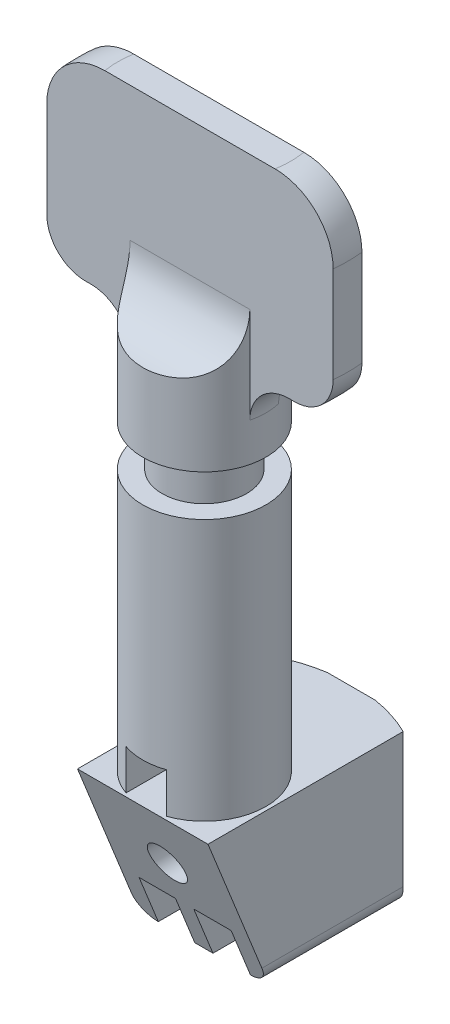
from build123d import *

# Parameters (mm, degrees)
BOSS_EXTRUDE1_DEPTH = 10
FILLET2_R           = 2
FILLET3_R           = 3
BOSS_EXTRUDE3_START = 5.5
SKETCH5_W           = 6.8
SKETCH5_H           = 15.3
SKETCH5_W_2         = 1.95
SKETCH5_H_2         = 13.3
SKETCH5_W_3         = 1.9
BOSS_EXTRUDE3_DEPTH = 2.5
SKETCH7_W           = 6.8
SKETCH7_H           = 15.3
BOSS_EXTRUDE4_DEPTH = 5.5
FILLET7_START       = -3.4
FILLET7_DEPTH       = 6.8
FILLET7_START_2     = -9
FILLET7_2_DEPTH     = 18
SKETCH8_R           = 0.975
CUT_EXTRUDE2_DEPTH  = 51.714038513
CUT_EXTRUDE4_DEPTH  = 50.587359306
CUT_EXTRUDE5_DEPTH  = 1.8
SKETCH14_R          = 1.95
CUT_EXTRUDE6_DEPTH  = 3.5
SKETCH17_W          = 2.1
SKETCH17_H          = 2.1
CUT_EXTRUDE8_DEPTH  = 51.714038513
BOSS_EXTRUDE5_START = -15.3
SKETCH18_W          = 1.9
SKETCH18_H          = 2
BOSS_EXTRUDE5_DEPTH = 15.3
SKETCH19_W          = 1.9
SKETCH19_H          = 0.1
CUT_EXTRUDE9_DEPTH  = 10.87055
SKETCH20_R          = 1.9
SKETCH20_R_2        = 1.075
BOSS_EXTRUDE6_DEPTH = 1.5
SKETCH21_R          = 12.317587445
SKETCH21_R_2        = 7.75
CUT_EXTRUDE10_DEPTH = 49.952489235


with BuildPart() as part:
    # Sketch1 → Revolve1 (revolve)
    with BuildSketch(Plane.XY, mode=Mode.PRIVATE) as revolve1_sk:
        Polygon((3.210554255, 37.765821371), (3.210554255, 33.765821371), (2.198784107, 33.765821371), (2.198784107, 31.615821371), (3.210554255, 31.615821371), (3.210554255, 18), (0, 18), (0, 37.765821371), align=None)
    revolve(revolve1_sk.sketch.rotate(Axis((0, 37.765821371, 0), (0, -1, 0)), 90), axis=Axis((0, 37.765821371, 0), (0, -1, 0)))

    # Sketch2 → Boss-Extrude1 (add)
    with BuildSketch(Plane(origin=(0, 37.765821371, 0), x_dir=(1, 0, 0), z_dir=(0, 1, 0))):
        with BuildLine():
            Line((3.121723662, 0.75), (-3.121723662, 0.75))
            ThreePointArc((-3.121723662, 0.75), (-3.210554255, 0), (-3.121723662, -0.75))
            Line((-3.121723662, -0.75), (3.121723662, -0.75))
            ThreePointArc((3.121723662, -0.75), (3.188269265, -0.377621131), (3.210554255, 0))
            ThreePointArc((3.210554255, 0), (3.188269265, 0.377621131), (3.121723662, 0.75))
        make_face()
        with BuildLine():
            Line((-3.121723662, 0.75), (-7.462405778, 0.75))
            ThreePointArc((-7.462405778, 0.75), (-7.5, 0), (-7.462405778, -0.75))
            Line((-7.462405778, -0.75), (-3.121723662, -0.75))
            ThreePointArc((-3.121723662, -0.75), (-3.210554255, 0), (-3.121723662, 0.75))
        make_face()
        with BuildLine():
            ThreePointArc((7.5, 0), (7.490595548, 0.375470813), (7.462405778, 0.75))
            Line((7.462405778, 0.75), (3.121723662, 0.75))
            ThreePointArc((3.121723662, 0.75), (3.188269265, 0.377621131), (3.210554255, 0))
            ThreePointArc((3.210554255, 0), (3.188269265, -0.377621131), (3.121723662, -0.75))
            Line((3.121723662, -0.75), (7.462405778, -0.75))
            ThreePointArc((7.462405778, -0.75), (7.490595548, -0.375470813), (7.5, 0))
        make_face()
    extrude(amount=BOSS_EXTRUDE1_DEPTH)

    # Fillet2
    # the kernel refuses this fillet: 2 mm, written as the material it adds along each edge
    with BuildSketch(Plane(origin=(0, 37.765821371, 0), x_dir=(0.2205776552735497, 0, 0.9753694161670351), z_dir=(0.9753694161670351, 0, -0.2205776552735497))) as fillet2_piece_1_section:
        with BuildLine():
            CenterArc((3.210554255 + FILLET2_R, FILLET2_R), FILLET2_R, 180, 90)
            Line((3.210554255 + FILLET2_R, 0), (3.210554255, 0))
            Line((3.210554255, 0), (3.210554255, FILLET2_R))
        make_face()
    fillet2_piece_1 = revolve(axis=Axis((0, 37.765821371, 0), (0, -1, 0)), revolution_arc=205.485927446, mode=Mode.PRIVATE)
    fillet2_piece_1 = split(fillet2_piece_1, bisect_by=Plane(origin=(0, 37.765821371, 0.75), z_dir=(0, 0, -1)), keep=Keep.TOP, mode=Mode.PRIVATE)
    fillet2_piece_1 = split(fillet2_piece_1, bisect_by=Plane(origin=(0, 37.765821371, -0.75), z_dir=(0, 0, 1)), keep=Keep.TOP, mode=Mode.PRIVATE)
    add(fillet2_piece_1)
    with BuildSketch(Plane(origin=(0, 37.765821371, 0), x_dir=(-0.22057765527352385, 0, -0.9753694161670411), z_dir=(-0.9753694161670411, 0, 0.22057765527352385))) as fillet2_piece_2_section:
        with BuildLine():
            CenterArc((3.210554255 + FILLET2_R, FILLET2_R), FILLET2_R, 180, 90)
            Line((3.210554255 + FILLET2_R, 0), (3.210554255, 0))
            Line((3.210554255, 0), (3.210554255, FILLET2_R))
        make_face()
    fillet2_piece_2 = revolve(axis=Axis((0, 37.765821371, 0), (0, -1, 0)), revolution_arc=205.485927446, mode=Mode.PRIVATE)
    fillet2_piece_2 = split(fillet2_piece_2, bisect_by=Plane(origin=(0, 37.765821371, 0.75), z_dir=(0, 0, -1)), keep=Keep.TOP, mode=Mode.PRIVATE)
    fillet2_piece_2 = split(fillet2_piece_2, bisect_by=Plane(origin=(0, 37.765821371, -0.75), z_dir=(0, 0, 1)), keep=Keep.TOP, mode=Mode.PRIVATE)
    add(fillet2_piece_2)
    # the kernel refuses this fillet: 2 mm, written as the material it takes off along each edge
    with BuildSketch(Plane(origin=(0, 37.765821371, 0), x_dir=(-0.7201079494948177, 0, -0.6938620475817721), z_dir=(0.6938620475817721, 0, -0.7201079494948177))) as fillet2_2_piece_1:
        with BuildLine():
            CenterArc((7.5 - FILLET2_R, FILLET2_R), FILLET2_R, 270, 90)
            Line((7.5, FILLET2_R), (7.5, 0))
            Line((7.5, 0), (7.5 - FILLET2_R, 0))
        make_face()
    revolve(axis=Axis((0, 37.765821371, 0), (0, 1, 0)), revolution_arc=87.873212667, mode=Mode.SUBTRACT)
    with BuildSketch(Plane(origin=(0, 37.765821371, 0), x_dir=(0.7201079494948216, 0, 0.6938620475817678), z_dir=(-0.6938620475817678, 0, 0.7201079494948216))) as fillet2_2_piece_2:
        with BuildLine():
            CenterArc((7.5 - FILLET2_R, FILLET2_R), FILLET2_R, 270, 90)
            Line((7.5, FILLET2_R), (7.5, 0))
            Line((7.5, 0), (7.5 - FILLET2_R, 0))
        make_face()
    revolve(axis=Axis((0, 37.765821371, 0), (0, 1, 0)), revolution_arc=87.873212667, mode=Mode.SUBTRACT)

    # Fillet3
    # the kernel refuses this fillet: 3 mm, written as the material it adds along each edge
    with BuildSketch(Plane(origin=(10.621723662, 37.765821371, -0.75), x_dir=(0, 1, 0), z_dir=(-1, 0, 0))) as fillet3_piece_1_section:
        with BuildLine():
            CenterArc((FILLET3_R, FILLET3_R), FILLET3_R, 180, 90)
            Line((0, FILLET3_R), (0, 0))
            Line((0, 0), (FILLET3_R, 0))
        make_face()
    fillet3_piece_1 = extrude(amount=21.243447325, mode=Mode.PRIVATE)
    fillet3_piece_1 = fillet3_piece_1 & Plane(origin=(0, 37.765821371, 0), x_dir=(0, 0, 1), z_dir=(0, -1, 0)) * Cylinder(3.210554255, 55, mode=Mode.PRIVATE)
    add(fillet3_piece_1)
    with BuildSketch(Plane(origin=(10.621723662, 37.765821371, 0.75), x_dir=(0, 1, 0), z_dir=(-1, 0, 0))) as fillet3_piece_2_section:
        with BuildLine():
            CenterArc((FILLET3_R, -FILLET3_R), FILLET3_R, 90, 90)
            Line((0, -FILLET3_R), (0, 0))
            Line((0, 0), (FILLET3_R, 0))
        make_face()
    fillet3_piece_2 = extrude(amount=21.243447325, mode=Mode.PRIVATE)
    fillet3_piece_2 = fillet3_piece_2 & Plane(origin=(0, 37.765821371, 0), x_dir=(0, 0, 1), z_dir=(0, -1, 0)) * Cylinder(3.210554255, 55, mode=Mode.PRIVATE)
    add(fillet3_piece_2)
    # the kernel refuses this fillet: 3 mm, written as the material it takes off along each edge
    with BuildSketch(Plane(origin=(0, 47.765821371, 0), x_dir=(-0.45344108598997085, 0, -0.891286251176487), z_dir=(0.891286251176487, 0, -0.45344108598997085))) as fillet3_2_piece_1:
        with BuildLine():
            CenterArc((7.5 - FILLET3_R, -FILLET3_R), FILLET3_R, 360, 90)
            Line((7.5 - FILLET3_R, 0), (7.5, 0))
            Line((7.5, 0), (7.5, -FILLET3_R))
        make_face()
    revolve(axis=Axis((0, 47.765821371, 0), (0, 1, 0)), revolution_arc=126.070648523, mode=Mode.SUBTRACT)
    with BuildSketch(Plane(origin=(0, 47.765821371, 0), x_dir=(0.4534410859901425, 0, -0.8912862511763997), z_dir=(-0.8912862511763997, 0, -0.4534410859901425))) as fillet3_2_piece_2:
        with BuildLine():
            CenterArc((7.5 - FILLET3_R, FILLET3_R), FILLET3_R, 270, 90)
            Line((7.5, FILLET3_R), (7.5, 0))
            Line((7.5, 0), (7.5 - FILLET3_R, 0))
        make_face()
    revolve(axis=Axis((0, 47.765821371, 0), (0, -1, 0)), revolution_arc=126.070648523, mode=Mode.SUBTRACT)



with BuildPart() as body_2:
    # Sketch5 → Boss-Extrude3 (new body)
    with BuildSketch(Plane.XZ.offset(-18).offset(BOSS_EXTRUDE3_START)):
        Rectangle(SKETCH5_W, SKETCH5_H)
        with Locations((1.425, 0)):
            Rectangle(SKETCH5_W_2, SKETCH5_H_2, mode=Mode.SUBTRACT)
        with Locations((-1.45, 0)):
            Rectangle(SKETCH5_W_3, SKETCH5_H_2, mode=Mode.SUBTRACT)
    extrude(amount=BOSS_EXTRUDE3_DEPTH)


with BuildPart() as part_1:
    add(part.part)

    add(body_2.part)  # Boss-Extrude4 merges body 2
    # Sketch7 → Boss-Extrude4 (add)
    with BuildSketch(Plane.XZ.offset(-18)):
        Rectangle(SKETCH7_W, SKETCH7_H)
    extrude(amount=BOSS_EXTRUDE4_DEPTH)

    # Fillet7: read off the stored shape, not the designer's step
    # Fillet7 outline → Fillet7 (cut)
    with BuildSketch(Plane.YZ.offset(FILLET7_START)):
        with BuildLine():
            Line((10, 7.65), (10, 6.65))
            ThreePointArc((10, 6.65), (10.292893219, 7.357106781), (11, 7.65))
            Line((11, 7.65), (10, 7.65))
        make_face()
        with BuildLine():
            ThreePointArc((11, -7.65), (10.292893219, -7.357106781), (10, -6.65))
            Line((10, -6.65), (10, -7.65))
            Line((10, -7.65), (11, -7.65))
        make_face()
    extrude(amount=FILLET7_DEPTH, mode=Mode.SUBTRACT)

    # Fillet7 2 outline → Fillet7 2 (cut)
    with BuildSketch(Plane.XY.offset(FILLET7_START_2)):
        with BuildLine():
            Line((-3.4, 10), (-2.4, 10))
            ThreePointArc((-2.4, 10), (-3.107106781, 10.292893219), (-3.4, 11))
            Line((-3.4, 11), (-3.4, 10))
        make_face()
        with BuildLine():
            Line((3.4, 10), (3.4, 11))
            ThreePointArc((3.4, 11), (3.107106781, 10.292893219), (2.4, 10))
            Line((2.4, 10), (3.4, 10))
        make_face()
    extrude(amount=FILLET7_2_DEPTH, mode=Mode.SUBTRACT)

    # Sketch8 → Cut-Extrude2 (cut, through all)
    with BuildSketch(Plane.XY.offset(7.65)):
        with Locations((0, 14.8)):
            Circle(SKETCH8_R)
    extrude(amount=-CUT_EXTRUDE2_DEPTH, mode=Mode.SUBTRACT)

    # Sketch11 → Cut-Extrude4 (cut, through all)
    with BuildSketch(Plane.ZY.offset(3.4)):
        Polygon((3.220554255, 18), (1, 10), (0, 10), (3.210554255, 18), align=None)
    extrude(amount=-CUT_EXTRUDE4_DEPTH, mode=Mode.SUBTRACT)


with BuildPart() as cut_extrude4_piece_1:
    # of the separate pieces the step leaves, piece 1, a body of its own (cut_extrude4_pieces)
    add(part_1.part.solids().sort_by_distance((3.4, 11, -7.65))[0])

    # Sketch13 → Cut-Extrude5 (cut)
    with BuildSketch(Plane.XY):
        with BuildLine():
            Line((-1.112435565, 12.7), (0, 12.7))
            ThreePointArc((0, 12.7), (2.1, 14.8), (0, 16.9))
            Line((0, 16.9), (-1.112435565, 16.9))
            Line((-1.112435565, 16.9), (-2.324871131, 14.8))
            Line((-2.324871131, 14.8), (-1.112435565, 12.7))
        make_face()
        with BuildLine():
            ThreePointArc((0, 16.9), (2.1, 14.8), (0, 12.7))
            Line((0, 12.7), (1.312435565, 12.7))
            Line((1.312435565, 12.7), (2.524871131, 14.8))
            Line((2.524871131, 14.8), (1.312435565, 16.9))
            Line((1.312435565, 16.9), (0, 16.9))
        make_face()
        with BuildLine():
            Line((-6.8, 12.7), (-1.112435565, 12.7))
            Line((-1.112435565, 12.7), (-2.324871131, 14.8))
            Line((-2.324871131, 14.8), (-1.112435565, 16.9))
            Line((-1.112435565, 16.9), (-6.8, 16.9))
            ThreePointArc((-6.8, 16.9), (-8.9, 14.8), (-6.8, 12.7))
        make_face()
    extrude(amount=-CUT_EXTRUDE5_DEPTH, mode=Mode.SUBTRACT)

    # Sketch17 → Cut-Extrude8 (cut, through all)
    with BuildSketch(Plane.XY.offset(7.65)):
        with Locations((0, 19.05)):
            Rectangle(SKETCH17_W, SKETCH17_H)
    extrude(amount=-CUT_EXTRUDE8_DEPTH, mode=Mode.SUBTRACT)


with BuildPart() as cut_extrude4_piece_2:
    # of the separate pieces the step leaves, piece 2, a body of its own (cut_extrude4_pieces)
    add(part_1.part.solids().sort_by_distance((3.4, 11, 7.65))[0])

    # Sketch14 → Cut-Extrude6 (cut)
    with BuildSketch(Plane.XY.offset(7.65)):
        with Locations((0, 14.8)):
            Circle(SKETCH14_R)
    extrude(amount=-CUT_EXTRUDE6_DEPTH, mode=Mode.SUBTRACT)

    # Sketch18 → Boss-Extrude5 (add)
    with BuildSketch(Plane.XY.offset(7.65).offset(BOSS_EXTRUDE5_START)):
        with Locations((0, 19)):
            Rectangle(SKETCH18_W, SKETCH18_H)
    extrude(amount=BOSS_EXTRUDE5_DEPTH)

    # Sketch19 → Cut-Extrude9 (cut)
    with BuildSketch(Plane(origin=(0, 0, -7.65), x_dir=(-1, 0, 0), z_dir=(0, 0, -1))):
        with Locations((0, 18.05)):
            Rectangle(SKETCH19_W, SKETCH19_H)
    extrude(amount=-CUT_EXTRUDE9_DEPTH, mode=Mode.SUBTRACT)


with BuildPart() as body_3:
    # Sketch20 → Boss-Extrude6 (new body)
    with BuildSketch(Plane.XY.offset(7.65)):
        with Locations((0, 14.8)):
            Circle(SKETCH20_R)
        with Locations((0, 14.8)):
            Circle(SKETCH20_R_2, mode=Mode.SUBTRACT)
    extrude(amount=-BOSS_EXTRUDE6_DEPTH)


with BuildPart() as cut_extrude10_tool:
    # Sketch21 → Cut-Extrude10 (new, through all)
    with BuildSketch(Plane(origin=(0, 0, 0), x_dir=(1, 0, 0), z_dir=(0, 1, 0))):
        Circle(SKETCH21_R)
        Circle(SKETCH21_R_2, mode=Mode.SUBTRACT)
    extrude(amount=CUT_EXTRUDE10_DEPTH)


with BuildPart() as cut_extrude4_piece_1_1:
    add(cut_extrude4_piece_1.part)

    # Cut-Extrude10: cut by cut_extrude10_tool
    add(cut_extrude10_tool.part, mode=Mode.SUBTRACT)


with BuildPart() as cut_extrude4_piece_2_1:
    add(cut_extrude4_piece_2.part)

    # Cut-Extrude10: cut by cut_extrude10_tool
    add(cut_extrude10_tool.part, mode=Mode.SUBTRACT)


with BuildPart() as body_3_1:
    add(body_3.part)

    # Cut-Extrude10: cut by cut_extrude10_tool
    add(cut_extrude10_tool.part, mode=Mode.SUBTRACT)


solid = cut_extrude4_piece_1_1.part
